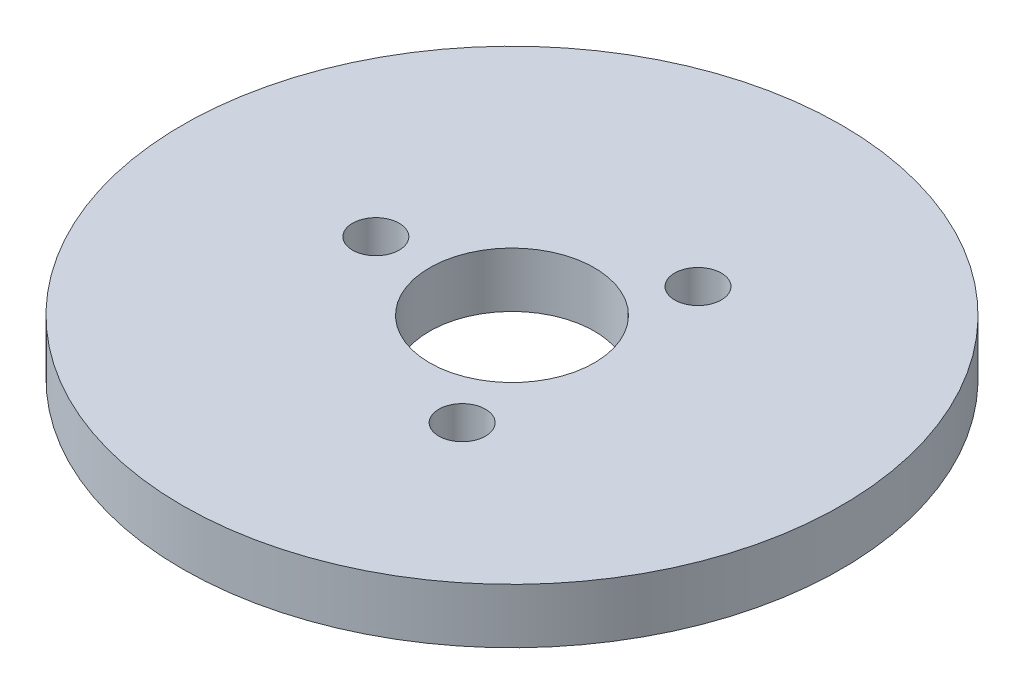
from build123d import *

# Parameters (mm, degrees)
SKETCH1_R           = 90
BOSS_EXTRUDE1_DEPTH = 15
SKETCH2_R           = 22.5
CUT_EXTRUDE1_DEPTH  = 129.16005618
SKETCH3_R           = 6.376860878
CUT_EXTRUDE2_DEPTH  = 14.447793932
CIRPATTERN1_COUNT   = 3


with BuildPart() as part:
    # Sketch1 → Boss-Extrude1 (new body)
    with BuildSketch(Plane(origin=(0, 0, 0), x_dir=(1, 0, 0), z_dir=(0, 1, 0))):
        Circle(SKETCH1_R)
    extrude(amount=BOSS_EXTRUDE1_DEPTH)

    # Sketch2 → Cut-Extrude1 (cut, through all)
    with BuildSketch(Plane(origin=(0, 0, 0), x_dir=(1, 0, 0), z_dir=(0, 1, 0))):
        Circle(SKETCH2_R)
    extrude(amount=CUT_EXTRUDE1_DEPTH, mode=Mode.SUBTRACT)

    # Sketch3 → Cut-Extrude2 (cut)
    with BuildSketch(Plane(origin=(0, 15, 0), x_dir=(1, 0, 0), z_dir=(0, 1, 0))):
        with Locations((-37.181399965, 0)):
            Circle(SKETCH3_R)
    cut_extrude2 = extrude(amount=-CUT_EXTRUDE2_DEPTH, mode=Mode.SUBTRACT)

    # CirPattern1: Cut-Extrude2 ×3 about axis
    cirpattern1_axis = Axis((0, 0, 0), (0, 1, 0))
    for i in range(1, CIRPATTERN1_COUNT):
        add(cut_extrude2.rotate(cirpattern1_axis, i * 360 / CIRPATTERN1_COUNT), mode=Mode.SUBTRACT)


solid = part.part
